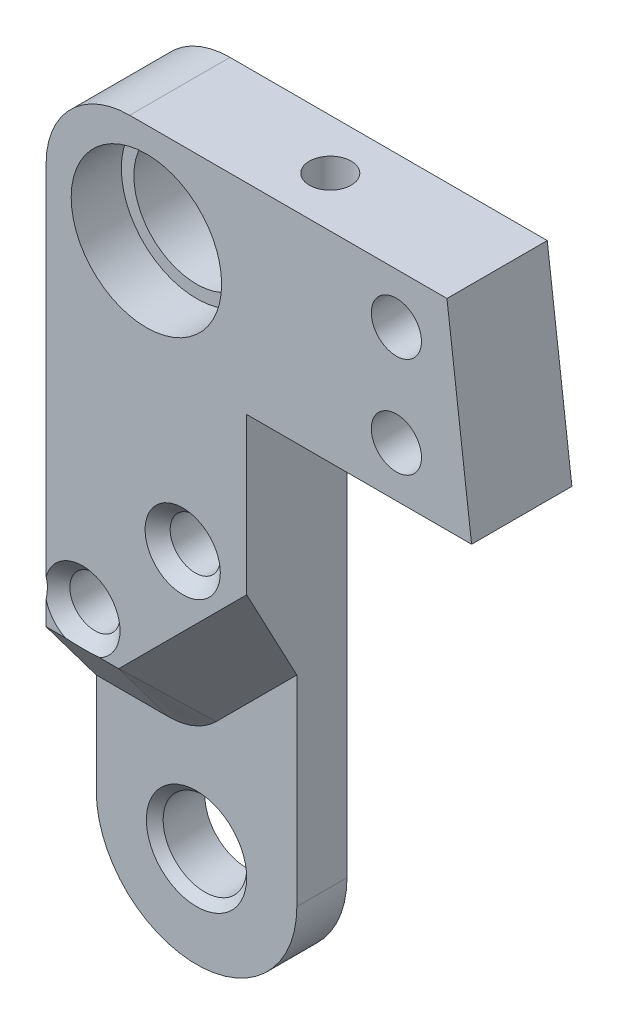
from build123d import *
from OCP.BRepFilletAPI import BRepFilletAPI_MakeChamfer

# Parameters (mm, degrees)
ESBO_O1_R                 = 4.5
RESSALTO_EXTRUS_O1_DEPTH  = 3
ESBO_O2_R                 = 4.5
RESSALTO_EXTRUS_O2_DEPTH  = 3
CHANFRO1_SIZE             = 4
CHANFRO1_SIZE_2           = 3
FURO_ROSCADO_DE_M3X0_51_D = 2.5
ESBO_O6_R                 = 4.5
ESBO_O6_R_2               = 3.75
RESSALTO_EXTRUS_O3_DEPTH  = 3
CORTE_EXTRUS_O1_REACH     = 51.391
ESBO_O7_R                 = 1.5
CORTE_EXTRUS_O2_REACH     = 51.391
ESBO_O8_R                 = 1.5
CHANFRO2_SIZE             = 0.75
CORTE_EXTRUS_O4_REACH     = 51.391
ESBO_O14_R                = 2.5
CHANFRO3_SIZE             = 0.5
ESBO_O15_R                = 1.9
CORTE_EXTRUS_O5_DEPTH     = 1


# Some blends are built 0.0001 mm under size
with BuildPart() as part:
    # Esboço1 → Ressalto-extrusão1 (new body)
    with BuildSketch(Plane.XY):
        with BuildLine():
            Line((-6, 6), (-6, 39))
            Line((-6, 39), (-6, 40))
            ThreePointArc((-6, 40), (-4.535533906, 43.535533906), (-1, 45))
            Line((-1, 45), (17.98112418, 45))
            Line((17.98112418, 45), (19.454538911, 33))
            Line((19.454538911, 33), (17.98112418, 33))
            Line((17.98112418, 33), (6, 33))
            Line((6, 33), (6, 25))
            Line((6, 25), (6, 6))
            ThreePointArc((6, 6), (4.242640687, 1.757359313), (0, 0))
            ThreePointArc((0, 0), (-4.242640687, 1.757359313), (-6, 6))
        make_face()
        with Locations((0, 39)):
            Circle(ESBO_O1_R, mode=Mode.SUBTRACT)
    extrude(amount=RESSALTO_EXTRUS_O1_DEPTH)

    # Esboço2 → Ressalto-extrusão2 (add)
    with BuildSketch(Plane.XY.offset(3)):
        with BuildLine():
            Line((6, 25), (6, 18))
            Line((6, 18), (1.171572875, 13.171572875))
            ThreePointArc((1.171572875, 13.171572875), (-0.12612052, 12.30448187), (-1.656854249, 12))
            Line((-1.656854249, 12), (-6, 12))
            Line((-6, 12), (-6, 25))
            Line((-6, 25), (-6, 40))
            ThreePointArc((-6, 40), (-4.535533906, 43.535533906), (-1, 45))
            Line((-1, 45), (17.98112418, 45))
            Line((17.98112418, 45), (19.454538911, 33))
            Line((19.454538911, 33), (6, 33))
            Line((6, 33), (6, 25))
        make_face()
        with Locations((0, 39)):
            Circle(ESBO_O2_R, mode=Mode.SUBTRACT)
    extrude(amount=RESSALTO_EXTRUS_O2_DEPTH)

    # Chanfro1
    chanfro1_edges_1 = [part.edges().sort_by_distance(p)[0] for p in [
        (3.585786438, 15.585786438, 6),
    ]]
    chanfro1_side_1 = [part.faces().sort_by_distance(p)[0] for p in [
        (3.543360031, 15.628212844, 6),
    ]]
    chanfro1_edges_2 = [part.edges().sort_by_distance(p)[0] for p in [
        (-0.12612052, 12.30448187, 6),
    ]]
    chanfro1_side_2 = [part.faces().sort_by_distance(p)[0] for p in [
        (-0.149081526, 12.359914642, 6),
    ]]
    chanfro1_edges_3 = [part.edges().sort_by_distance(p)[0] for p in [
        (-3.828427125, 12, 6),
    ]]
    chanfro1_side_3 = [part.faces().sort_by_distance(p)[0] for p in [
        (-3.828427125, 12, 5.94),
    ]]
    chanfro1 = BRepFilletAPI_MakeChamfer(part.part.solid().wrapped)
    for e in chanfro1_edges_1:
        chanfro1.Add(CHANFRO1_SIZE - 0.0001, CHANFRO1_SIZE_2 - 0.0001, e.wrapped, chanfro1_side_1[0].wrapped)
    for e in chanfro1_edges_2:
        chanfro1.Add(CHANFRO1_SIZE - 0.0001, CHANFRO1_SIZE_2 - 0.0001, e.wrapped, chanfro1_side_2[0].wrapped)
    for e in chanfro1_edges_3:
        chanfro1.Add(CHANFRO1_SIZE_2 - 0.0001, CHANFRO1_SIZE - 0.0001, e.wrapped, chanfro1_side_3[0].wrapped)
    add(Compound.cast(chanfro1.Shape()), mode=Mode.REPLACE)  # a hair under: the kernel refuses the full size

    # Furo roscado de M3x0.51 (through all)
    with Locations(Plane(origin=(0, 45, 0), x_dir=(1, 0, 0), z_dir=(0, 1, 0))):
        with Locations((8, -3)):
            Hole(FURO_ROSCADO_DE_M3X0_51_D / 2)

    # Esboço6 → Ressalto-extrusão3 (add)
    with BuildSketch(Plane(origin=(0, 0, 0), x_dir=(-1, 0, 0), z_dir=(0, 0, -1))):
        with Locations((0, 39)):
            Circle(ESBO_O6_R)
        with Locations((0, 39)):
            Circle(ESBO_O6_R_2, mode=Mode.SUBTRACT)
    extrude(amount=-RESSALTO_EXTRUS_O3_DEPTH)

    # Esboço7 → Corte-extrusão1 (cut, up to next)
    with BuildSketch(Plane(origin=(0, 0, 0), x_dir=(-1, 0, 0), z_dir=(0, 0, -1)), mode=Mode.PRIVATE) as corte_extrus_o1_sk1:
        with Locations((-14.954538911, 42)):
            Circle(ESBO_O7_R)
    corte_extrus_o1_tool1 = extrude(corte_extrus_o1_sk1.sketch, amount=-CORTE_EXTRUS_O1_REACH, mode=Mode.PRIVATE) & part.part
    # Esboço7 → Corte-extrusão1 (cut, up to next)
    with BuildSketch(Plane(origin=(0, 0, 0), x_dir=(-1, 0, 0), z_dir=(0, 0, -1)), mode=Mode.PRIVATE) as corte_extrus_o1_sk2:
        with Locations((-14.954538911, 36)):
            Circle(ESBO_O7_R)
    corte_extrus_o1_tool2 = extrude(corte_extrus_o1_sk2.sketch, amount=-CORTE_EXTRUS_O1_REACH, mode=Mode.PRIVATE) & part.part
    add(corte_extrus_o1_tool1.solids().sort_by_distance((14.954539, 42, 0))[0], mode=Mode.SUBTRACT)
    add(corte_extrus_o1_tool2.solids().sort_by_distance((14.954539, 36, 0))[0], mode=Mode.SUBTRACT)

    # Esboço8 → Corte-extrusão2 (cut, up to next)
    with BuildSketch(Plane.XY.offset(6), mode=Mode.PRIVATE) as corte_extrus_o2_sk1:
        with Locations((2.171572875, 24)):
            Circle(ESBO_O8_R)
    corte_extrus_o2_tool1 = extrude(corte_extrus_o2_sk1.sketch, amount=-CORTE_EXTRUS_O2_REACH, mode=Mode.PRIVATE) & part.part
    # Esboço8 → Corte-extrusão2 (cut, up to next)
    with BuildSketch(Plane.XY.offset(6), mode=Mode.PRIVATE) as corte_extrus_o2_sk2:
        with Locations((-3.828427125, 18)):
            Circle(ESBO_O8_R)
    corte_extrus_o2_tool2 = extrude(corte_extrus_o2_sk2.sketch, amount=-CORTE_EXTRUS_O2_REACH, mode=Mode.PRIVATE) & part.part
    add(corte_extrus_o2_tool1.solids().sort_by_distance((2.171573, 24, 6))[0], mode=Mode.SUBTRACT)
    add(corte_extrus_o2_tool2.solids().sort_by_distance((-3.828427, 18, 6))[0], mode=Mode.SUBTRACT)

    # Chanfro2
    # the kernel refuses this chamfer: 0.75 mm, written as the material it takes off along each edge
    with BuildSketch(Plane(origin=(2.171572875, 24, 6), x_dir=(1, 0, 0), z_dir=(0, -1, 0))) as chanfro2_piece_1:
        Polygon((1.5 + CHANFRO2_SIZE, 0), (1.5, -CHANFRO2_SIZE), (1.5, 0), align=None)
    revolve(axis=Axis((2.171572875, 24, 6), (0, 0, 1)), mode=Mode.SUBTRACT)
    with BuildSketch(Plane(origin=(-3.828427125, 18, 6), x_dir=(1, 0, 0), z_dir=(0, -1, 0))) as chanfro2_piece_2:
        Polygon((1.5 + CHANFRO2_SIZE, 0), (1.5, -CHANFRO2_SIZE), (1.5, 0), align=None)
    revolve(axis=Axis((-3.828427125, 18, 6), (0, 0, 1)), mode=Mode.SUBTRACT)

    # Esboço14 → Corte-extrusão4 (cut, up to next)
    with BuildSketch(Plane(origin=(0, 0, 0), x_dir=(-1, 0, 0), z_dir=(0, 0, -1)), mode=Mode.PRIVATE) as corte_extrus_o4_sk1:
        with Locations((0, 6)):
            Circle(ESBO_O14_R)
    corte_extrus_o4_tool1 = extrude(corte_extrus_o4_sk1.sketch, amount=-CORTE_EXTRUS_O4_REACH, mode=Mode.PRIVATE) & part.part
    add(corte_extrus_o4_tool1.solids().sort_by_distance((0, 6, 0))[0], mode=Mode.SUBTRACT)

    # Chanfro3
    chanfro3_edges = [part.edges().sort_by_distance(p)[0] for p in [
        (2.5, 6, 3),
    ]]
    chamfer(chanfro3_edges, length=CHANFRO3_SIZE)

    # Esboço15 → Corte-extrusão5 (cut)
    with BuildSketch(Plane(origin=(0, 0, 0), x_dir=(-1, 0, 0), z_dir=(0, 0, -1))):
        with Locations((-2.171572875, 24)):
            Circle(ESBO_O15_R)
        with Locations((3.828427125, 18)):
            Circle(ESBO_O15_R)
    extrude(amount=-CORTE_EXTRUS_O5_DEPTH, mode=Mode.SUBTRACT)


solid = part.part
